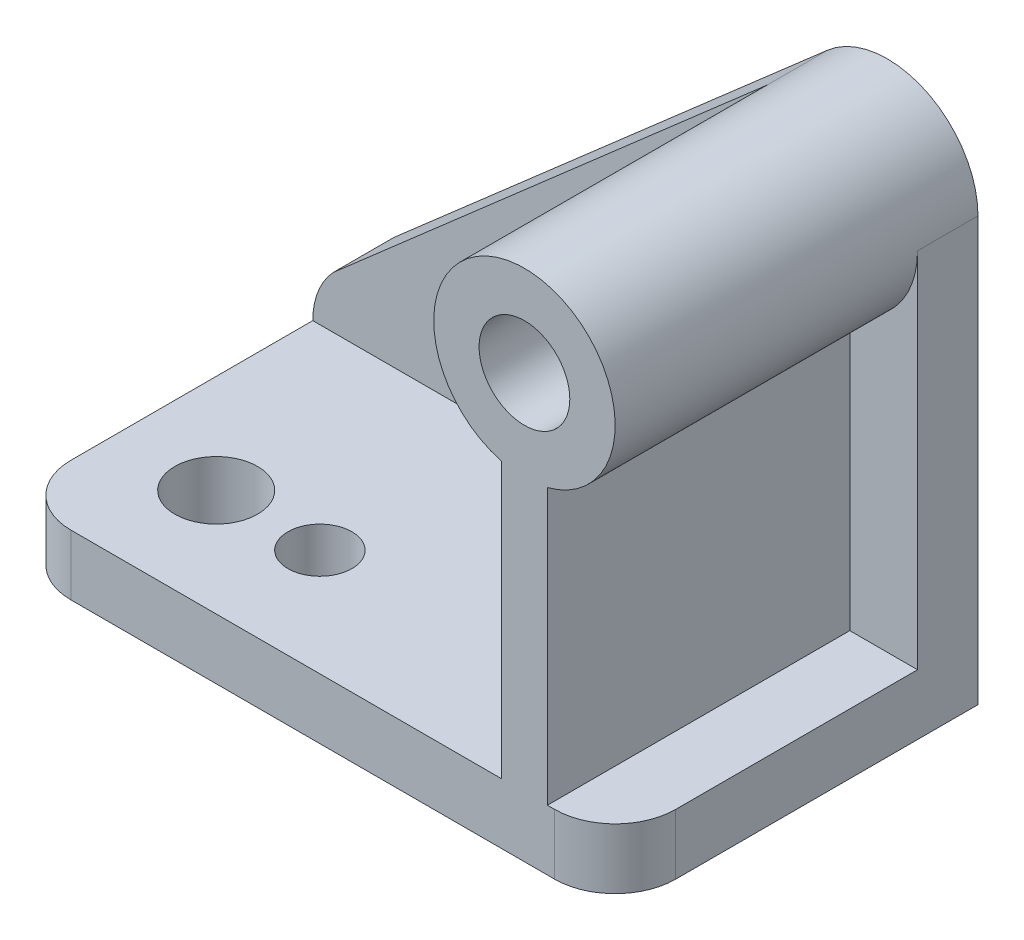
from build123d import *

# Parameters (mm, degrees)
SKETCH1_W            = 127
SKETCH1_H            = 12.7
BOSS_EXTRUDE1_DEPTH  = 76.2
FILLET2_R            = 12.7
BOSS_EXTRUDE3_DEPTH  = 76.2
BOSS_EXTRUDE4_DEPTH  = 12.7
SKETCH3_R            = 8.693712638
SKETCH3_R_2          = 6.718686286
CUT_EXTRUDE2_DEPTH   = 177.090892723
SKETCH1_8_R          = 9.525
CUT_EXTRUDE3_DEPTH   = 159.75
SHELL4_START         = 2.54
SHELL4_OUTLINE_R     = 12.065
SHELL4_DEPTH         = 41.911304946
SHELL4_2_DEPTH       = 7.62
SHELL4_START_2       = 62.968677719
SHELL4_3_OUTLINE_R   = 12.065
SHELL4_3_DEPTH       = 0.531322281
SHELL4_START_3       = -50.8
SHELL4_4_DEPTH       = 10.16
SHELL4_START_4       = -40.64
SHELL4_5_OUTLINE_W   = 4.572
SHELL4_5_OUTLINE_H   = 18.517372773
SHELL4_5_OUTLINE_H_2 = 10.16
SHELL4_5_DEPTH       = 66.6749999
SHELL4_6_DEPTH       = 10.16
SHELL4_START_5       = 44.451304946
SHELL4_7_OUTLINE_R   = 12.065
SHELL4_7_DEPTH       = 29.208695054


with BuildPart() as part:
    # Sketch1 → Boss-Extrude1 (new body)
    with BuildSketch(Plane.XY):
        with Locations((-63.5, -44.45)):
            Rectangle(SKETCH1_W, SKETCH1_H)
    extrude(amount=BOSS_EXTRUDE1_DEPTH)

    # Fillet2
    fillet2_edges = [part.edges().sort_by_distance(p)[0] for p in [
        (-127, -44.45, 76.2),
        (0, -44.45, 76.2),
    ]]
    fillet(fillet2_edges, radius=FILLET2_R)

    # Sketch1<6> → Boss-Extrude3 (add)
    with BuildSketch(Plane.XY):
        with BuildLine():
            ThreePointArc((-14.224, 19.671429138), (-19.05, 57.15), (-23.876, 19.671429138))
            Line((-23.876, 19.671429138), (-23.876, -38.1))
            Line((-23.876, -38.1), (-14.224, -38.1))
            Line((-14.224, -38.1), (-14.224, 19.671429138))
        make_face()
    extrude(amount=BOSS_EXTRUDE3_DEPTH)

    # Sketch1<7> → Boss-Extrude4 (add)
    with BuildSketch(Plane.XY):
        with BuildLine():
            ThreePointArc((-23.876, 19.671429138), (-37.59378257, 33.737589198), (-31.585775702, 52.444226279))
            Line((-31.585775702, 52.444226279), (-122.686278821, -27.170766624))
            ThreePointArc((-122.686278821, -27.170766624), (-125.882553095, -32.225131223), (-127, -38.1))
            Line((-127, -38.1), (-23.876, -38.1))
            Line((-23.876, -38.1), (-23.876, 19.671429138))
        make_face()
        with BuildLine():
            Line((0, -38.1), (0, 38.1))
            ThreePointArc((0, 38.1), (-3.969585549, 26.460257735), (-14.224, 19.671429138))
            Line((-14.224, 19.671429138), (-14.224, -38.1))
            Line((-14.224, -38.1), (0, -38.1))
        make_face()
    extrude(amount=BOSS_EXTRUDE4_DEPTH)

    # Sketch3 → Cut-Extrude2 (cut, through all)
    with BuildSketch(Plane(origin=(0, -38.1, 0), x_dir=(1, 0, 0), z_dir=(0, 1, 0))):
        with Locations(Location((-106.276718745, -53.709991333, 0), (0, 0, 180))):
            Circle(SKETCH3_R)
        with Locations(Location((-84.500771906, -53.709991333, 0), (0, 0, 180))):
            Circle(SKETCH3_R_2)
    extrude(amount=-CUT_EXTRUDE2_DEPTH, mode=Mode.SUBTRACT)

    # Sketch1<8> → Cut-Extrude3 (cut, through all)
    with BuildSketch(Plane.XY):
        with Locations((-19.05, 38.1)):
            Circle(SKETCH1_8_R)
    extrude(amount=CUT_EXTRUDE3_DEPTH, mode=Mode.SUBTRACT)

    # Shell4: read off the stored shape, not the designer's step
    # Shell4 outline → Shell4 (cut)
    with BuildSketch(Plane.XY.offset(SHELL4_START)):
        with BuildLine():
            ThreePointArc((-16.764, 21.74902743), (-19.05, 54.61), (-21.336, 21.74902743))
            Line((-21.336, 21.74902743), (-21.336, -40.64))
            Line((-21.336, -40.64), (-124.46, -40.64))
            Line((-124.46, -40.64), (-124.46, -50.8))
            Line((-124.46, -50.8), (-2.54, -50.8))
            Line((-2.54, -50.8), (-2.54, -40.64))
            Line((-2.54, -40.64), (-16.764, -40.64))
            Line((-16.764, -40.64), (-16.764, 21.74902743))
        make_face()
        with Locations((-19.05, 38.1)):
            Circle(SHELL4_OUTLINE_R, mode=Mode.SUBTRACT)
    extrude(amount=SHELL4_DEPTH, mode=Mode.SUBTRACT)

    # Shell4 2 outline → Shell4 2 (cut)
    with BuildSketch(Plane.XY.offset(SHELL4_START)):
        with BuildLine():
            Line((-21.336, -40.64), (-21.336, 21.74902743))
            ThreePointArc((-21.336, 21.74902743), (-34.872227338, 33.384364087), (-29.914338942, 50.531662775))
            Line((-29.914338942, 50.531662775), (-120.914264565, -28.995432955))
            ThreePointArc((-120.914264565, -28.995432955), (-123.542285503, -33.214680644), (-124.46, -38.1))
            Line((-124.46, -38.1), (-124.46, -40.64))
            Line((-124.46, -40.64), (-21.336, -40.64))
        make_face()
        with BuildLine():
            Line((-2.54, -40.64), (-2.54, 38.1))
            ThreePointArc((-2.54, 38.1), (-6.593636968, 27.263989664), (-16.764, 21.74902743))
            Line((-16.764, 21.74902743), (-16.764, -40.64))
            Line((-16.764, -40.64), (-2.54, -40.64))
        make_face()
    extrude(amount=SHELL4_2_DEPTH, mode=Mode.SUBTRACT)

    # Shell4 3 outline → Shell4 3 (cut)
    with BuildSketch(Plane.XY.offset(SHELL4_START_2)):
        with BuildLine():
            ThreePointArc((-16.764, 21.74902743), (-19.05, 54.61), (-21.336, 21.74902743))
            Line((-21.336, 21.74902743), (-21.336, -40.64))
            Line((-21.336, -40.64), (-124.46, -40.64))
            Line((-124.46, -40.64), (-124.46, -50.8))
            Line((-124.46, -50.8), (-2.54, -50.8))
            Line((-2.54, -50.8), (-2.54, -40.64))
            Line((-2.54, -40.64), (-16.764, -40.64))
            Line((-16.764, -40.64), (-16.764, 21.74902743))
        make_face()
        with Locations((-19.05, 38.1)):
            Circle(SHELL4_3_OUTLINE_R, mode=Mode.SUBTRACT)
    extrude(amount=SHELL4_3_DEPTH, mode=Mode.SUBTRACT)

    # Shell4 4 outline → Shell4 4 (cut)
    with BuildSketch(Plane(origin=(0, 0, 0), x_dir=(1, 0, 0), z_dir=(0, 1, 0)).offset(SHELL4_START_3)):
        with BuildLine():
            Line((-2.54, -62.968677719), (-2.54, -44.451304946))
            Line((-2.54, -44.451304946), (-84.500771906, -44.451305047))
            ThreePointArc((-84.500771906, -44.451305047), (-75.24208562, -53.709991333), (-84.500771906, -62.968677619))
            Line((-84.500771906, -62.968677619), (-2.54, -62.968677719))
        make_face()
        with BuildLine():
            ThreePointArc((-12.7, -73.66), (-5.515795103, -70.684204897), (-2.54, -63.5))
            Line((-2.54, -63.5), (-100.767451105, -63.5))
            ThreePointArc((-100.767451105, -63.5), (-106.276718745, -64.943703971), (-111.785986385, -63.5))
            Line((-111.785986385, -63.5), (-124.46, -63.5))
            ThreePointArc((-124.46, -63.5), (-121.484204897, -70.684204897), (-114.3, -73.66))
            Line((-114.3, -73.66), (-12.7, -73.66))
        make_face()
        with BuildLine():
            ThreePointArc((-84.500771906, -62.968677619), (-93.759458192, -53.709991333), (-84.500771906, -44.451305047))
            Line((-84.500771906, -44.451305047), (-99.914877343, -44.451304946))
            ThreePointArc((-99.914877343, -44.451304946), (-95.043006107, -53.709991332), (-99.914877342, -62.968677719))
            Line((-99.914877342, -62.968677719), (-84.500771906, -62.968677619))
        make_face()
        with BuildLine():
            ThreePointArc((-112.638560148, -62.968677719), (-117.510431383, -53.709991332), (-112.638560147, -44.451304946))
            Line((-112.638560147, -44.451304946), (-124.46, -44.451304946))
            Line((-124.46, -44.451304946), (-124.46, -62.968677719))
            Line((-124.46, -62.968677719), (-112.638560148, -62.968677719))
        make_face()
    extrude(amount=SHELL4_4_DEPTH, mode=Mode.SUBTRACT)

    # Shell4 5 outline → Shell4 5 (cut)
    with BuildSketch(Plane(origin=(0, 0, 0), x_dir=(1, 0, 0), z_dir=(0, 1, 0)).offset(SHELL4_START_4)):
        with Locations((-19.05, -53.709991333)):
            Rectangle(SHELL4_5_OUTLINE_W, SHELL4_5_OUTLINE_H)
        with Locations((-19.05, -68.58)):
            Rectangle(SHELL4_5_OUTLINE_W, SHELL4_5_OUTLINE_H_2)
    extrude(amount=SHELL4_5_DEPTH, mode=Mode.SUBTRACT)

    # Shell4 6 outline → Shell4 6 (add)
    with BuildSketch(Plane(origin=(0, 0, 0), x_dir=(1, 0, 0), z_dir=(0, 1, 0)).offset(SHELL4_START_3)):
        with BuildLine():
            Line((-112.638560147, -44.451304946), (-99.914877343, -44.451304946))
            ThreePointArc((-99.914877343, -44.451304946), (-106.276718745, -42.476278695), (-112.638560147, -44.451304946))
        make_face()
        with BuildLine():
            Line((-111.785986385, -63.5), (-100.767451105, -63.5))
            ThreePointArc((-100.767451105, -63.5), (-100.335222021, -63.243873874), (-99.914877342, -62.968677719))
            Line((-99.914877342, -62.968677719), (-112.638560148, -62.968677719))
            ThreePointArc((-112.638560148, -62.968677719), (-112.218215469, -63.243873874), (-111.785986385, -63.5))
        make_face()
    extrude(amount=SHELL4_6_DEPTH)

    # Shell4 7 outline → Shell4 7 (cut)
    with BuildSketch(Plane.XY.offset(SHELL4_START_5)):
        with BuildLine():
            ThreePointArc((-16.764, 21.74902743), (-19.05, 54.61), (-21.336, 21.74902743))
            Line((-21.336, 21.74902743), (-19.05, 21.429425891))
            Line((-19.05, 21.429425891), (-16.764, 21.74902743))
        make_face()
        with Locations((-19.05, 38.1)):
            Circle(SHELL4_7_OUTLINE_R, mode=Mode.SUBTRACT)
    extrude(amount=SHELL4_7_DEPTH, mode=Mode.SUBTRACT)


solid = part.part
